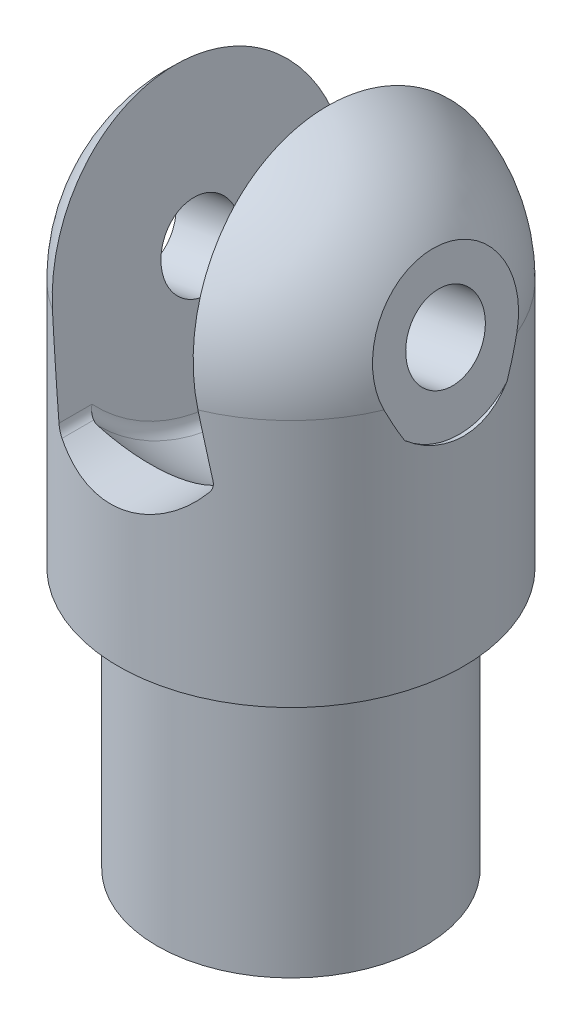
from build123d import *

# Parameters (mm, degrees)
SKETCH1_R                     = 12.9921
BOSS_EXTRUDE1_DEPTH           = 25.4
CUT_EXTRUDE1_DEPTH            = 103.901771343
CUT_EXTRUDE1_DEPTH_BACK       = 103.901771343
SKETCH3_R                     = 3.81
CUT_REVOLVE10_ANGLE           = 180
CUT_REVOLVE10_OTHER_WAY_ANGLE = 90
CUT_EXTRUDE4_DEPTH            = 32.004
FILLET1_R                     = 1.27
SKETCH15_R                    = 7.62
CUT_EXTRUDE5_DEPTH            = 10.16


with BuildPart() as part:
    # Sketch1 → Boss-Extrude1 (new body)
    with BuildSketch(Plane(origin=(0, 0, 0), x_dir=(1, 0, 0), z_dir=(0, 1, 0))):
        Circle(SKETCH1_R)
    extrude(amount=BOSS_EXTRUDE1_DEPTH)

    # Sketch2 → Revolve1 (revolve)
    with BuildSketch(Plane(origin=(0, 0, 0), x_dir=(0, 0, -1), z_dir=(1, 0, 0))):
        with BuildLine():
            Line((-16.764, 25.4), (-16.764, 49.53))
            ThreePointArc((-16.764, 49.53), (-11.85393808, 61.38393808), (0, 66.294))
            Line((0, 66.294), (0, 25.4))
            Line((0, 25.4), (-16.764, 25.4))
        make_face()
    revolve(axis=Axis((0, 25.4, 0), (0, 1, 0)))

    # Sketch3 → Cut-Extrude1 (cut, two sides: drawn at the far end of the back side and taken through both)
    with BuildSketch(Plane(origin=(-8.60079424, 98.307528007, 0), x_dir=(0, 0, -1), z_dir=(-0.9848077530122086, -0.17364817766692736, 0)).offset(-CUT_EXTRUDE1_DEPTH_BACK)):
        with Locations((0, 49.53)):
            Circle(SKETCH3_R)
    extrude(amount=CUT_EXTRUDE1_DEPTH + CUT_EXTRUDE1_DEPTH_BACK, mode=Mode.SUBTRACT)

    # Sketch11 → Cut-Revolve10 (revolve, cut)
    with BuildSketch(Plane.XY):
        with BuildLine():
            Line((-8.754940924, 47.986267701), (-11.555365064, 63.868262211))
            ThreePointArc((-11.555365064, 63.868262211), (-4.563194159, 67.370669384), (3.251927555, 67.655594947))
            Line((3.251927555, 67.655594947), (6.253529232, 50.632665928))
            Line((6.253529232, 50.632665928), (-8.754940924, 47.986267701))
        make_face()
    revolve(axis=Axis((17.384942968, 52.595434503, 0), (-0.9848077530122086, -0.1736481776669275, 0)), revolution_arc=CUT_REVOLVE10_ANGLE, mode=Mode.SUBTRACT)

    # Sketch11 → Cut-Revolve10 other way (revolve, cut)
    with BuildSketch(Plane.XY):
        with BuildLine():
            Line((-8.754940924, 47.986267701), (-11.555365064, 63.868262211))
            ThreePointArc((-11.555365064, 63.868262211), (-4.563194159, 67.370669384), (3.251927555, 67.655594947))
            Line((3.251927555, 67.655594947), (6.253529232, 50.632665928))
            Line((6.253529232, 50.632665928), (-8.754940924, 47.986267701))
        make_face()
    revolve(axis=Axis((17.384942968, 52.595434503, 0), (0.9848077530122086, 0.1736481776669275, 0)), revolution_arc=CUT_REVOLVE10_OTHER_WAY_ANGLE, mode=Mode.SUBTRACT)

    # Sketch13 → Cut-Revolve11 (revolve, cut)
    with BuildSketch(Plane.XY):
        with BuildLine():
            Line((-9.416540481, 51.73838524), (5.591929675, 54.384783467))
            Line((5.591929675, 54.384783467), (2.68080809, 70.894574384))
            ThreePointArc((2.68080809, 70.894574384), (-5.110036595, 71.196819125), (-12.327662066, 68.248176156))
            Line((-12.327662066, 68.248176156), (-9.416540481, 51.73838524))
        make_face()
    revolve(axis=Axis((-9.416540481, 51.73838524, 0), (0.9848077530122086, 0.17364817766692786, 0)), mode=Mode.SUBTRACT)

    # Sketch14 → Cut-Extrude4 (cut)
    with BuildSketch(Plane.XY):
        with BuildLine():
            Line((-8.754940924, 47.986267701), (-7.458475861, 40.63364896))
            ThreePointArc((-7.458475861, 40.63364896), (0.601772913, 38.803537705), (7.549994294, 43.280047188))
            Line((7.549994294, 43.280047188), (6.253529232, 50.632665928))
            Line((6.253529232, 50.632665928), (-8.754940924, 47.986267701))
        make_face()
    extrude(amount=CUT_EXTRUDE4_DEPTH, mode=Mode.SUBTRACT)

    # Fillet1
    fillet1_edges = [part.edges().sort_by_distance(p)[0] for p in [
        (-6.426497219, 34.781007249, -8.959886792),
        (-6.229967841, 33.666433756, 0),
        (-6.754324012, 36.640205378, 6.782727573),
        (-7.458475861, 40.63364896, 13.709505428),
        (7.549994294, 43.280047188, 13.686598415),
        (8.254146144, 39.286603605, 6.782727573),
        (8.879091084, 35.74236473, 0),
        (8.863774451, 35.829229672, -8.534320119),
    ]]
    fillet(fillet1_edges, radius=FILLET1_R)

    # Sketch15 → Cut-Extrude5 (cut)
    with BuildSketch(Plane(origin=(-6.538341306, -1.152885981, 0), x_dir=(0, 0, -1), z_dir=(-0.9848077530122086, -0.17364817766692736, 0))):
        with Locations((0, -48.777528007)):
            Circle(SKETCH15_R)
    cut_extrude5 = extrude(amount=CUT_EXTRUDE5_DEPTH, mode=Mode.SUBTRACT)

    # Mirror1: Cut-Extrude5 across plane
    add(cut_extrude5.mirror(Plane(origin=(8.470128849, 1.493512246, 0), x_dir=(0, 0, 1), z_dir=(-0.9848077530122086, -0.17364817766692736, 0))), mode=Mode.SUBTRACT)


solid = part.part
